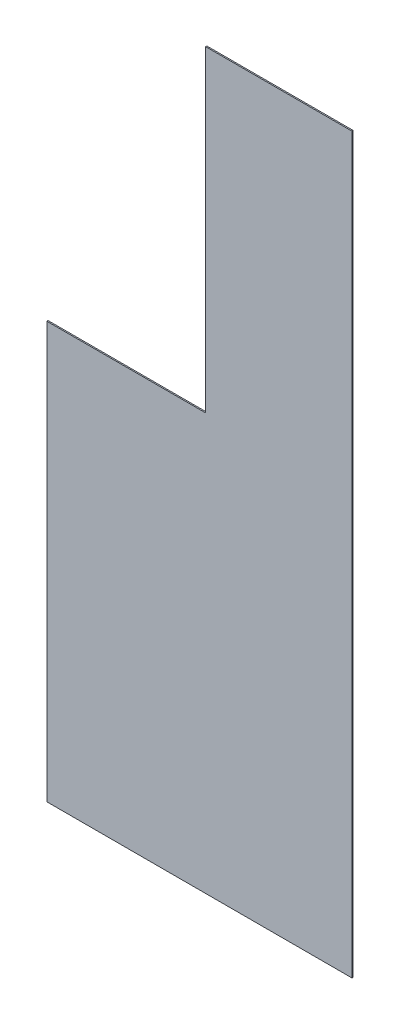
from build123d import *

# Parameters (mm, degrees)
TABAN_FLAN_1_DEPTH = 10


# Sheet-metal steps are written as plain solids
with BuildPart() as part:
    # Çizim1 → Taban-Flanş1 (new body)
    with BuildSketch(Plane.XY):
        Polygon((0, 0), (0, 3417), (1305, 3417), (1305, 6021), (2506, 6021), (2506, 0), align=None)
    extrude(amount=-TABAN_FLAN_1_DEPTH)


solid = part.part
